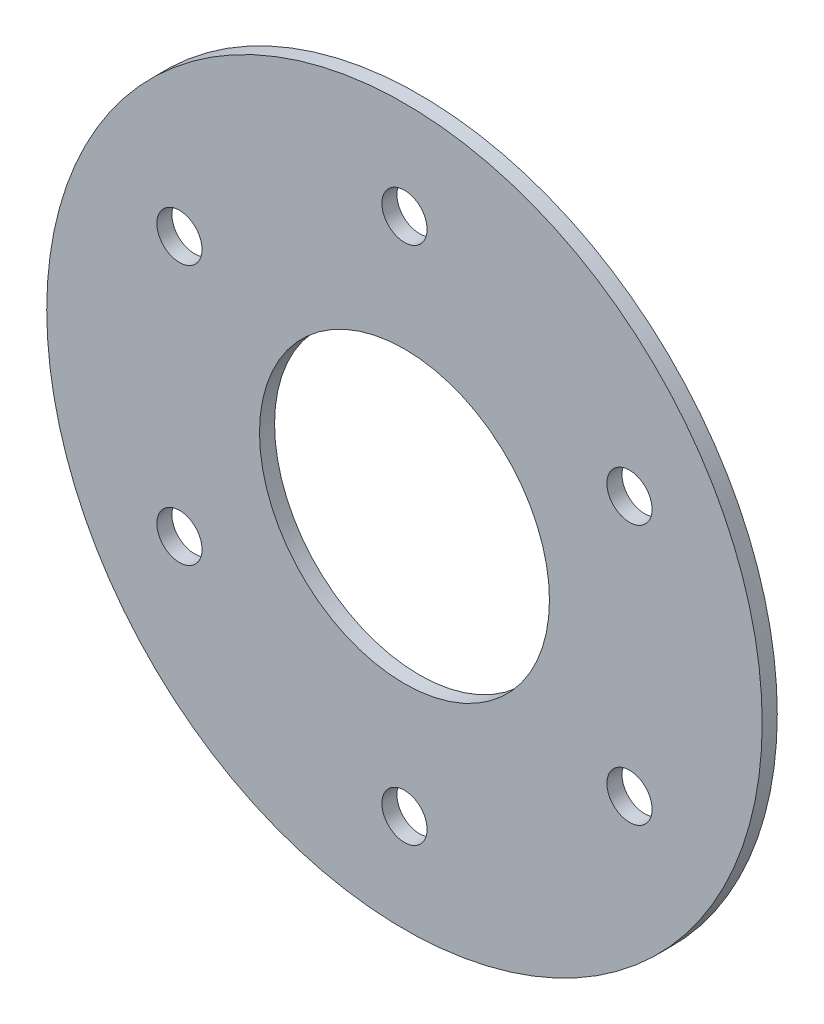
from build123d import *

# Parameters (mm, degrees)
SKETCH_1_R             = 95
SKETCH_1_R_2           = 38.5
SKETCH_1_R_3           = 6
SM_BASE_FLANGE_1_DEPTH = 4


# Sheet-metal steps are written as plain solids
with BuildPart() as part:
    # Sketch 1 → Базовая кромка1 (new body)
    with BuildSketch(Plane.XY):
        Circle(SKETCH_1_R)
        Circle(SKETCH_1_R_2, mode=Mode.SUBTRACT)
        with Locations((0, 69)):
            Circle(SKETCH_1_R_3, mode=Mode.SUBTRACT)
        with Locations((59.755752861, 34.5)):
            Circle(SKETCH_1_R_3, mode=Mode.SUBTRACT)
        with Locations((59.755752861, -34.5)):
            Circle(SKETCH_1_R_3, mode=Mode.SUBTRACT)
        with Locations((0, -69)):
            Circle(SKETCH_1_R_3, mode=Mode.SUBTRACT)
        with Locations((-59.755752861, -34.5)):
            Circle(SKETCH_1_R_3, mode=Mode.SUBTRACT)
        with Locations((-59.755752861, 34.5)):
            Circle(SKETCH_1_R_3, mode=Mode.SUBTRACT)
    extrude(amount=SM_BASE_FLANGE_1_DEPTH)


solid = part.part
